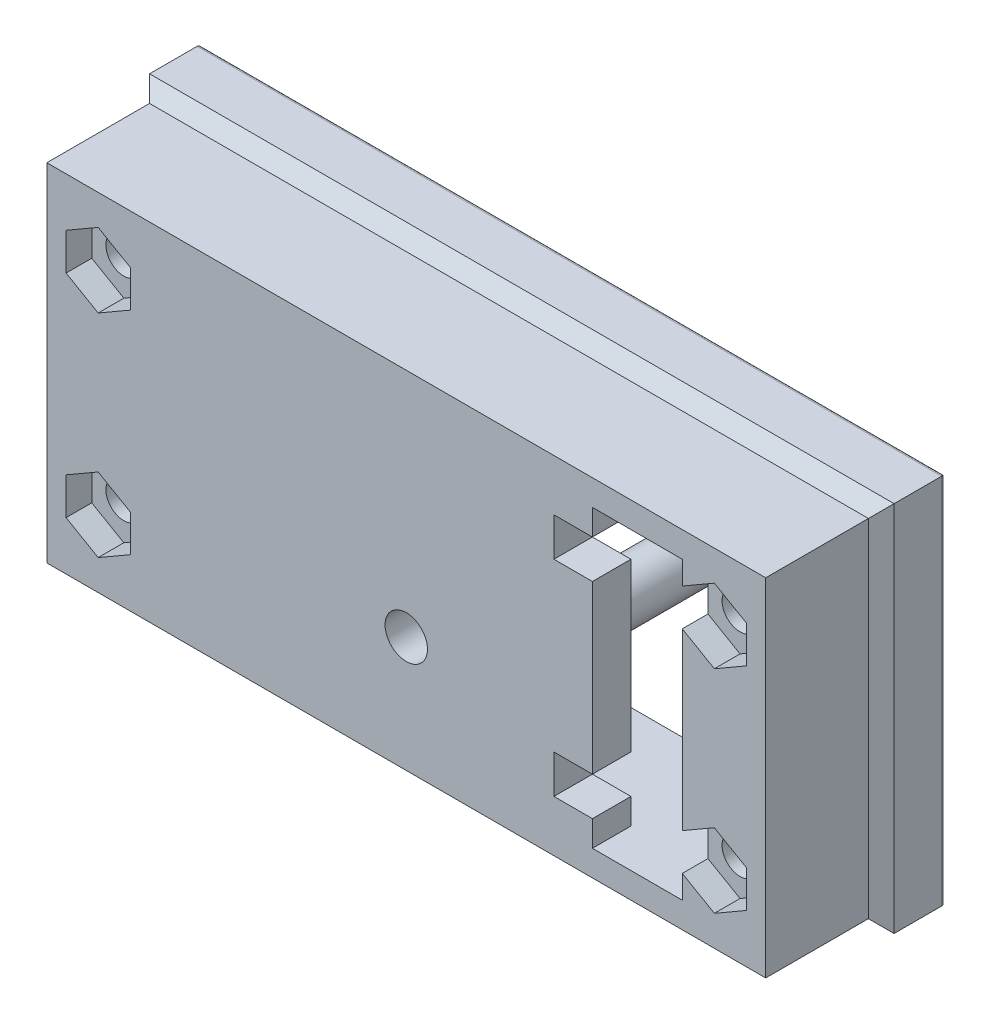
from build123d import *

# Parameters (mm, degrees)
BOSS_EXTRUDE1_DEPTH      = 8
SKETCH2_W                = 55.999999999999986
SKETCH2_H                = 27.00000000000001
BOSS_EXTRUDE2_DEPTH      = 3
CUT_EXTRUDE1_DEPTH       = 3
SKETCH5_R                = 1.9999999999999996
BOSS_EXTRUDE3_DEPTH      = 9.7
FILLET1_R                = 2
SKETCH6_R                = 1.3999999999999992
CUT_EXTRUDE2_DEPTH       = 10
CUT_EXTRUDE3_DEPTH       = 2
SKETCH11_R               = 1.6500000000000004
SKETCH11_W               = 3
SKETCH11_H               = 2.9999999999999973
CUT_EXTRUDE4_DEPTH       = 10
BOSS_EXTRUDE5_START      = 10
SKETCH10_R               = 1.3999999999999992
BOSS_EXTRUDE5_DEPTH      = 10
BOSS_EXTRUDE6_START      = 12.5
SKETCH10_5_R             = 1.3999999999999992
BOSS_EXTRUDE6_DEPTH      = 12.5
BOSS_EXTRUDE7_DEPTH      = 2
BOSS_EXTRUDE7_DEPTH_BACK = 2
SKETCH12_W               = 55.999999999999986
SKETCH12_H               = 27.000000000000014
BOSS_EXTRUDE8_DEPTH      = 3
FILLET2_R                = 0.3
FILLET3_R                = 0.3
CHAMFER1_SIZE            = 1


with BuildPart() as part:
    # Sketch1 → Boss-Extrude1 (new body)
    with BuildSketch(Plane.XY):
        Polygon((27.999999999999982, -13.499999999999995), (-28.000000000000004, -13.500000000000002), (-27.999999999999996, 13.500000000000005), (27.999999999999982, 13.500000000000012), align=None)
        Polygon((25.999999999999996, -11.499999999999993), (-26.000000000000004, -11.500000000000002), (-26.000000000000004, 11.499999999999998), (25.999999999999996, 11.500000000000005), align=None, mode=Mode.SUBTRACT)
    extrude(amount=BOSS_EXTRUDE1_DEPTH)

    # Sketch2 → Boss-Extrude2 (add)
    with BuildSketch(Plane.XY.offset(8)):
        Rectangle(SKETCH2_W, SKETCH2_H)
    extrude(amount=BOSS_EXTRUDE2_DEPTH)

    # Sketch4 → Cut-Extrude1 (cut)
    with BuildSketch(Plane(origin=(0, 0, 8), x_dir=(-1, 0, 0), z_dir=(0, 0, -1))):
        Polygon((-21.499999999999993, 11.500000000000005), (-14.499999999999993, 11.500000000000005), (-14.499999999999993, -11.500000000000002), (-21.49999999999999, -11.500000000000002), align=None)
    extrude(amount=-CUT_EXTRUDE1_DEPTH, mode=Mode.SUBTRACT)

    # Sketch5 → Boss-Extrude3 (add)
    with BuildSketch(Plane(origin=(0, 0, 8), x_dir=(-1, 0, 0), z_dir=(0, 0, -1))):
        with Locations(Location((-10, 0, 0), (0, 0, 180))):
            Circle(SKETCH5_R)
    extrude(amount=BOSS_EXTRUDE3_DEPTH)

    # Fillet1
    fillet1_edges = [part.edges().sort_by_distance(p)[0] for p in [
        (8, -4.9e-16, 8),
    ]]
    fillet(fillet1_edges, radius=FILLET1_R)

    # Sketch6 → Cut-Extrude2 (cut)
    with BuildSketch(Plane(origin=(0, 0, 8), x_dir=(-1, 0, 0), z_dir=(0, 0, -1))):
        with Locations((24, 8.25)):
            Circle(SKETCH6_R)
        with Locations((24, -8.25)):
            Circle(SKETCH6_R)
        with Locations((-23.999999999999986, 8.25)):
            Circle(SKETCH6_R)
        with Locations((-23.999999999999986, -8.25)):
            Circle(SKETCH6_R)
    extrude(amount=-CUT_EXTRUDE2_DEPTH, mode=Mode.SUBTRACT)

    # Sketch8 → Cut-Extrude3 (cut)
    with BuildSketch(Plane.XY.offset(11)):
        Polygon((-26.5, 9.693375672974062), (-26.5, 6.806624327025934), (-24.000000000000004, 5.363248654051871), (-21.500000000000004, 6.806624327025935), (-21.500000000000004, 9.693375672974065), (-23.999999999999996, 11.136751345948126), align=None)
        Polygon((-24, -5.363248654051871), (-26.500000000000004, -6.806624327025933), (-26.5, -9.693375672974067), (-24.000000000000007, -11.136751345948127), (-21.5, -9.693375672974062), (-21.5, -6.806624327025935), align=None)
        Polygon((23.999999999999982, 11.136751345948133), (21.49999999999998, 9.693375672974065), (21.49999999999998, 6.8066243270259355), (23.999999999999982, 5.363248654051871), (26.49999999999999, 6.806624327025936), (26.499999999999986, 9.693375672974069), align=None)
        Polygon((23.999999999999986, -5.363248654051867), (21.499999999999982, -6.806624327025933), (21.499999999999986, -9.693375672974069), (23.999999999999982, -11.136751345948134), (26.49999999999999, -9.693375672974067), (26.49999999999999, -6.806624327025933), align=None)
    extrude(amount=-CUT_EXTRUDE3_DEPTH, mode=Mode.SUBTRACT)

    # Sketch11 → Cut-Extrude4 (cut)
    with BuildSketch(Plane(origin=(0, 0, 8), x_dir=(-1, 0, 0), z_dir=(0, 0, -1))):
        with Locations((0, -4.500000000000003)):
            Circle(SKETCH11_R)
        Polygon((-14.499999999999995, 9.500000000000004), (-11.5, 9.500000000000005), (-11.499999999999996, 6.500000000000007), (-14.499999999999995, 6.500000000000007), align=None)
        with Locations((-12.999999999999996, -8.000000000000004)):
            Rectangle(SKETCH11_W, SKETCH11_H)
    extrude(amount=-CUT_EXTRUDE4_DEPTH, mode=Mode.SUBTRACT)

    # Sketch10 → Boss-Extrude5 (add)
    # profile 1 of 2: a face of its own
    with BuildSketch(Plane(origin=(0, 0, 8), x_dir=(-1, 0, 0), z_dir=(0, 0, -1)).offset(BOSS_EXTRUDE5_START)):
        with BuildLine():
            Line((26.000000000000004, 6.923350083857869), (26.000000000000004, 9.576649916142129))
            ThreePointArc((26.000000000000018, 9.576649916142133), (21.599999999999998, 8.25), (26.000000000000018, 6.923350083857866))
        make_face()
        with Locations((24, 8.25)):
            Circle(SKETCH10_R, mode=Mode.SUBTRACT)
    # profile 2 of 2: a face of its own
    with BuildSketch(Plane(origin=(0, 0, 8), x_dir=(-1, 0, 0), z_dir=(0, 0, -1)).offset(BOSS_EXTRUDE5_START)):
        with BuildLine():
            ThreePointArc((26.000000000000018, -6.923350083857867), (21.599999999999998, -8.249999999999998), (26.000000000000018, -9.576649916142136))
            Line((26.000000000000004, -9.57664991614213), (26.000000000000004, -6.92335008385787))
        make_face()
        with Locations((24, -8.25)):
            Circle(SKETCH10_R, mode=Mode.SUBTRACT)
    extrude(amount=-BOSS_EXTRUDE5_DEPTH)

    # Sketch10<5> → Boss-Extrude6 (add)
    # profile 1 of 2: a face of its own
    with BuildSketch(Plane(origin=(0, 0, 8), x_dir=(-1, 0, 0), z_dir=(0, 0, -1)).offset(BOSS_EXTRUDE6_START)):
        with BuildLine():
            ThreePointArc((-21.599999999999984, 8.25), (-23.307179676972474, 10.547825058615224), (-26.000000000000032, 9.57664991614209))
            Line((-25.999999999999996, 9.57664991614208), (-25.999999999999996, 6.923350083857921))
            ThreePointArc((-26.000000000000036, 6.923350083857913), (-23.307179676972478, 5.952174941384775), (-21.599999999999984, 8.25))
        make_face()
        with Locations((-23.999999999999986, 8.25)):
            Circle(SKETCH10_5_R, mode=Mode.SUBTRACT)
    # profile 2 of 2: a face of its own
    with BuildSketch(Plane(origin=(0, 0, 8), x_dir=(-1, 0, 0), z_dir=(0, 0, -1)).offset(BOSS_EXTRUDE6_START)):
        with BuildLine():
            Line((-25.999999999999996, -6.923350083857921), (-25.999999999999996, -9.57664991614208))
            ThreePointArc((-26.000000000000036, -9.576649916142088), (-23.307179676972478, -10.547825058615224), (-21.599999999999984, -8.25))
            ThreePointArc((-21.599999999999984, -8.25), (-23.307179676972474, -5.952174941384776), (-26.000000000000032, -6.92335008385791))
        make_face()
        with Locations((-23.999999999999986, -8.25)):
            Circle(SKETCH10_5_R, mode=Mode.SUBTRACT)
    extrude(amount=-BOSS_EXTRUDE6_DEPTH)

    # Sketch12 → Boss-Extrude7 (add, two sides: drawn at the far end of the back side and taken through both)
    with BuildSketch(Plane(origin=(0, 0, 0), x_dir=(-1, 0, 0), z_dir=(0, 0, -1)).offset(-BOSS_EXTRUDE7_DEPTH_BACK)):
        Polygon((-28.999999999999986, 14.500000000000012), (28.999999999999996, 14.500000000000012), (29.000000000000007, -14.500000000000002), (-28.999999999999982, -14.500000000000002), align=None)
        Rectangle(SKETCH12_W, SKETCH12_H, mode=Mode.SUBTRACT)
    extrude(amount=BOSS_EXTRUDE7_DEPTH + BOSS_EXTRUDE7_DEPTH_BACK)

    # Sketch14 → Boss-Extrude8 (add)
    with BuildSketch(Plane(origin=(0, 0, 8), x_dir=(-1, 0, 0), z_dir=(0, 0, -1))):
        Polygon((1.73e-15, 0.9848275573014404), (-4.749999999999997, -1.7575862213492788), (-4.7499999999999964, -7.242413778650725), (3.8e-16, -9.984827557301447), (4.749999999999999, -7.242413778650725), (4.749999999999999, -1.7575862213492808), align=None)
        Polygon((4.3e-16, -1.324573519457061), (-2.749999999999999, -2.9122867597285307), (-2.749999999999999, -6.087713240271473), (-1.13e-15, -7.675426480542943), (2.749999999999999, -6.087713240271473), (2.749999999999999, -2.912286759728532), align=None, mode=Mode.SUBTRACT)
    extrude(amount=BOSS_EXTRUDE8_DEPTH)

    # Fillet2
    fillet2_edges = [part.edges().sort_by_distance(p)[0] for p in [
        (-1.066e-14, 13.500000000000012, -2),
        (-1.066e-14, -13.500000000000002, -2),
        (27.999999999999982, 5.33e-15, -2),
        (-28.000000000000004, 5.33e-15, -2),
        (28.999999999999986, 5.33e-15, -2),
        (-1.421e-14, -14.500000000000002, -2),
        (-29, 5.33e-15, -2),
        (-7.11e-15, 14.500000000000012, -2),
    ]]
    fillet(fillet2_edges, radius=FILLET2_R)

    # Fillet3
    fillet3_edges = [part.edges().sort_by_distance(p)[0] for p in [
        (-22.6, 8.25, -2),
        (-26.000000000000004, 8.25, -2),
        (-21.599999999999998, 8.250000000000002, -2),
        (-22.6, -8.25, -2),
        (-26.000000000000004, -8.25, -2),
        (-21.599999999999998, -8.250000000000002, -2),
        (25.399999999999984, 8.25, -4.5),
        (25.999999999999996, 8.25, -4.5),
        (21.599999999999984, 8.25, -4.5),
        (25.999999999999996, -8.25, -4.5),
        (25.399999999999984, -8.25, -4.5),
        (21.599999999999984, -8.25, -4.5),
        (8, -4.9e-16, -1.6999999999999993),
    ]]
    fillet(fillet3_edges, radius=FILLET3_R - 0.0001)  # a hair under: the kernel refuses the full size

    # Chamfer1
    chamfer1_edges = [part.edges().sort_by_distance(p)[0] for p in [
        (-1.066e-14, 13.500000000000012, 2),
        (27.999999999999982, 5.33e-15, 2),
        (-1.066e-14, -13.500000000000002, 2),
        (-28.000000000000004, 5.33e-15, 2),
    ]]
    chamfer(chamfer1_edges, length=CHAMFER1_SIZE - 0.0001)  # a hair under: the kernel refuses the full size


solid = part.part
